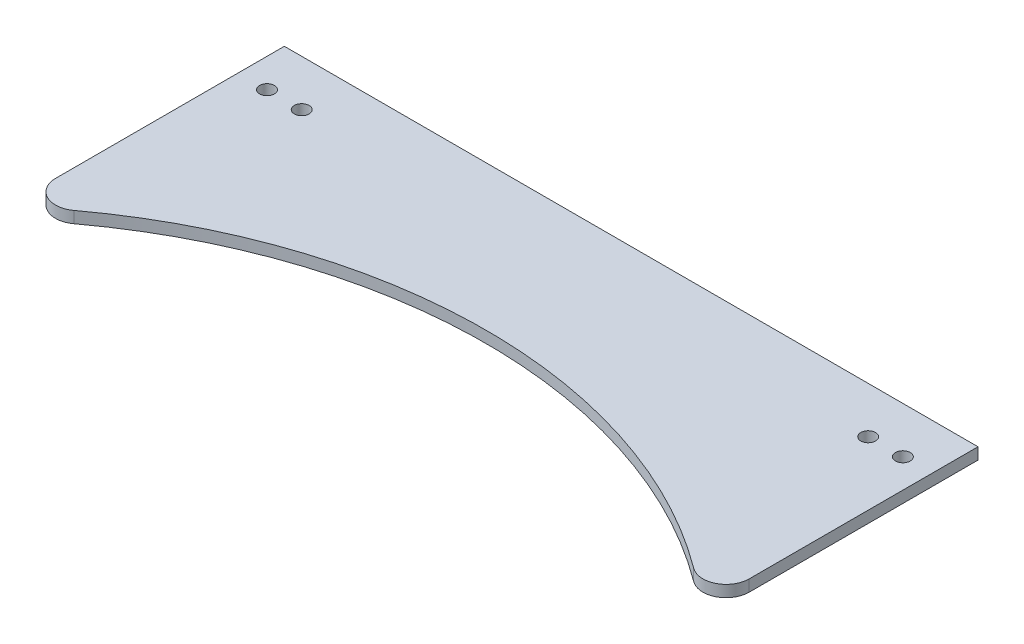
from build123d import *

# Parameters (mm, degrees)
BOSS_EXTRUDE1_DEPTH = 3.175
SKETCH3_R           = 2.032
CUT_EXTRUDE1_DEPTH  = 206.199343627
FILLET1_R           = 6.35


with BuildPart() as part:
    # Sketch1 → Boss-Extrude1 (new body)
    with BuildSketch(Plane(origin=(0, 0, 0), x_dir=(1, 0, 0), z_dir=(0, 1, 0))):
        with BuildLine():
            Line((0, 0), (0, 76.2))
            Line((0, 76.2), (190.5, 76.2))
            Line((190.5, 76.2), (190.5, 0))
            ThreePointArc((190.5, 0), (95.25, 36.382262572), (0, 0))
        make_face()
    extrude(amount=BOSS_EXTRUDE1_DEPTH)

    # Sketch3 → Cut-Extrude1 (cut, through all)
    with BuildSketch(Plane.XZ):
        with Locations((17.4625, -63.5)):
            Circle(SKETCH3_R)
        with Locations((7.9375, -63.5)):
            Circle(SKETCH3_R)
        with Locations((182.5625, -63.5)):
            Circle(SKETCH3_R)
        with Locations((173.0375, -63.5)):
            Circle(SKETCH3_R)
    extrude(amount=-CUT_EXTRUDE1_DEPTH, mode=Mode.SUBTRACT)

    # Fillet1
    fillet1_edges = [part.edges().sort_by_distance(p)[0] for p in [
        (0, 1.5875, 0),
        (190.5, 1.5875, 0),
    ]]
    fillet(fillet1_edges, radius=FILLET1_R)


solid = part.part
